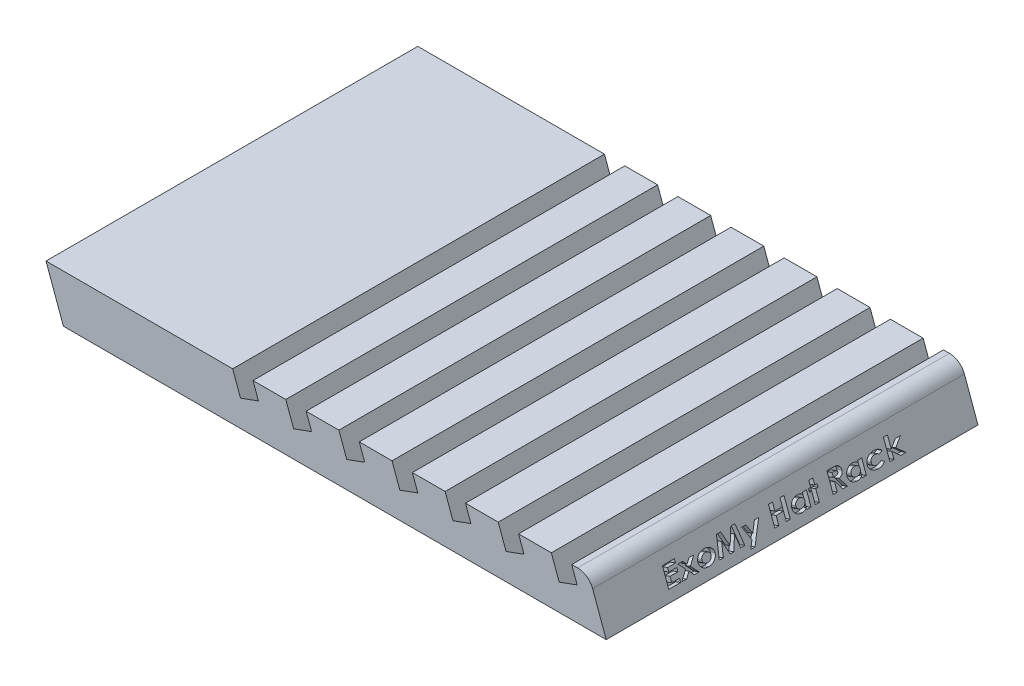
from build123d import *

# Parameters (mm, degrees)
SKETCH1_W               = 15
SKETCH1_H               = 70
BOSS_EXTRUDE1_DEPTH     = 9
CHAMFER1_SIZE           = 10.989909678
CHAMFER1_SIZE_2         = 4
CUT_EXTRUDE1_DEPTH      = 72.444995659
CUT_EXTRUDE1_DEPTH_BACK = 72.444995659
SKETCH2_W               = 16
SKETCH2_H               = 3.6
CUT_EXTRUDE2_START      = -2.4124
SKETCH3_W               = 70
SKETCH3_H               = 3.6
CUT_EXTRUDE2_DEPTH      = 4.310293
FILLET1_R               = 3
LPATTERN14_COUNT        = 7
LPATTERN14_PITCH        = 10
FILLET2_R               = 3
CUT_EXTRUDE3_DEPTH      = 1
MOVE_START              = -70
MOVE_FACE1_DEPTH        = 70
BODY_MOVE_COPY1_ANGLE   = 180


# Read off the part's stored shape, not the designer's step: Move Face1
with BuildPart() as part:
    # Sketch1 → Boss-Extrude1 (new body)
    with BuildSketch(Plane(origin=(0, 0, 0), x_dir=(1, 0, 0), z_dir=(0, 1, 0))):
        with Locations((7.5, 35)):
            Rectangle(SKETCH1_W, SKETCH1_H)
    extrude(amount=BOSS_EXTRUDE1_DEPTH)

    # Chamfer1
    # the kernel refuses this chamfer: 10.989909678, 4 mm, written as the material it takes off along each edge
    with BuildSketch(Plane(origin=(0, 9, -98.509965797), x_dir=(-0.013184058198645777, -0.9999130865277316, 0), z_dir=(0, 0, 1))) as chamfer1_piece_1:
        Polygon((CHAMFER1_SIZE * 0.999913086511, CHAMFER1_SIZE * 0.0131840581984), (-CHAMFER1_SIZE_2 * 0.0131840581986, CHAMFER1_SIZE_2 * 0.999913086528), (0, 0), align=None)
    extrude(amount=127.019931595, mode=Mode.SUBTRACT)
    with BuildSketch(Plane(origin=(15, 0, 28.509965797), x_dir=(0.013184058198645852, 0.9999130865277316, 0), z_dir=(0, 0, -1))) as chamfer1_piece_2:
        Polygon((CHAMFER1_SIZE * 0.999913086511, -CHAMFER1_SIZE * 0.0131840581984), (-CHAMFER1_SIZE_2 * 0.0131840581986, -CHAMFER1_SIZE_2 * 0.999913086528), (0, 0), align=None)
    extrude(amount=127.019931595, mode=Mode.SUBTRACT)

    # Sketch2 → Cut-Extrude1 (cut, two sides: drawn at the far end of the back side and taken through both)
    with BuildSketch(Plane(origin=(3.360455357, 9.232775213, 0), x_dir=(0, 0, 1), z_dir=(-0.3420201433256651, -0.9396926207859098, 0)).offset(-CUT_EXTRUDE1_DEPTH_BACK)):
        with Locations((-60.5, -5.508604011)):
            Rectangle(SKETCH2_W, SKETCH2_H)
        with Locations((-9.5, -5.508604011)):
            Rectangle(SKETCH2_W, SKETCH2_H)
    extrude(amount=CUT_EXTRUDE1_DEPTH + CUT_EXTRUDE1_DEPTH_BACK, mode=Mode.SUBTRACT)

    # Sketch3 → Cut-Extrude2 (cut)
    with BuildSketch(Plane(origin=(3.360455357, 9.232775213, 0), x_dir=(0, 0, 1), z_dir=(-0.3420201433256651, -0.9396926207859098, 0)).offset(CUT_EXTRUDE2_START)):
        with Locations((-35, -5.508604011)):
            Rectangle(SKETCH3_W, SKETCH3_H)
    extrude(amount=CUT_EXTRUDE2_DEPTH, mode=Mode.SUBTRACT)

    # Fillet1
    # the kernel refuses this fillet: 3 mm, written as the material it takes off along each edge
    with BuildSketch(Plane(origin=(9.579178979, 4.949649375, -1.5), x_dir=(-0.3420201433256651, -0.9396926207859098, 0), z_dir=(-0.9396926207859098, 0.3420201433256651, 0))) as fillet1_piece_1:
        with BuildLine():
            CenterArc((2.598076211, 3), FILLET1_R, 210, 60)
            Line((0, 1.5), (0, 0))
            Line((0, 0), (2.598076211, 0))
        make_face()
    extrude(amount=3.6, mode=Mode.SUBTRACT)
    with BuildSketch(Plane(origin=(6.196285544, 6.180921891, -17.5), x_dir=(0, 0, -1), z_dir=(0.9396926207859098, -0.3420201433256651, 0)), Plane(origin=(6.196285544, 6.180921891, -52.5), x_dir=(-0.34202014332566505, -0.9396926207859096, 0), z_dir=(0.9396926207859098, -0.3420201433256651, 0))) as fillet1_piece_2:
        with BuildLine():
            CenterArc((FILLET1_R, -FILLET1_R), FILLET1_R, 90, 90)
            Line((0, -FILLET1_R), (0, 0))
            Line((0, 0), (FILLET1_R, 0))
        make_face()
    extrude(amount=3.6, mode=Mode.SUBTRACT)
    with BuildSketch(Plane(origin=(9.579178979, 4.949649375, -68.5), x_dir=(0, 0, -1), z_dir=(-0.9396926207859098, 0.3420201433256651, 0))) as fillet1_piece_3:
        with BuildLine():
            CenterArc((3, 2.598076211), FILLET1_R, 180, 60)
            Line((0, 2.598076211), (0, 0))
            Line((0, 0), (1.5, 0))
        make_face()
    extrude(amount=3.6, mode=Mode.SUBTRACT)


with BuildPart() as lpattern14_1:
    # LPattern14: pattern copy
    add(part.part.moved(Location(Vector(1, 0, 0) * (1 * LPATTERN14_PITCH))))


with BuildPart() as lpattern14_2:
    # LPattern14: pattern copy
    add(part.part.moved(Location(Vector(1, 0, 0) * (2 * LPATTERN14_PITCH))))


with BuildPart() as lpattern14_3:
    # LPattern14: pattern copy
    add(part.part.moved(Location(Vector(1, 0, 0) * (3 * LPATTERN14_PITCH))))


with BuildPart() as lpattern14_4:
    # LPattern14: pattern copy
    add(part.part.moved(Location(Vector(1, 0, 0) * (4 * LPATTERN14_PITCH))))


with BuildPart() as lpattern14_5:
    # LPattern14: pattern copy
    add(part.part.moved(Location(Vector(1, 0, 0) * (5 * LPATTERN14_PITCH))))


with BuildPart() as lpattern14_6:
    # LPattern14: pattern copy
    add(part.part.moved(Location(Vector(1, 0, 0) * (6 * LPATTERN14_PITCH))))


with BuildPart() as part_1:
    add(part.part)

    # Combine1: union LPattern14_6, LPattern14_1, LPattern14_2, LPattern14_3, LPattern14_4, LPattern14_5
    add(lpattern14_6.part)
    add(lpattern14_1.part)
    add(lpattern14_2.part)
    add(lpattern14_3.part)
    add(lpattern14_4.part)
    add(lpattern14_5.part)

    # Fillet2
    fillet2_edges = [part_1.edges().sort_by_distance(p)[0] for p in [
        (4, 9, -35),
    ]]
    fillet(fillet2_edges, radius=FILLET2_R)

    # Sketch4 → Cut-Extrude3 (cut)
    # profile 1 of 12: a face of its own
    with BuildSketch(Plane(origin=(0.639544643, -0.232775213, 0), x_dir=(0, 0, 1), z_dir=(-0.9396926207859098, 0.34202014332566516, 0))):
        Polygon((-57.604824266, 5.547488193), (-55.361234522, 5.547488193), (-55.361234522, 4.919283065), (-56.842003753, 4.919283065), (-56.842003753, 4.246206142), (-55.361234522, 4.246206142), (-55.361234522, 3.618001014), (-56.842003753, 3.618001014), (-56.842003753, 2.675693321), (-55.361234522, 2.675693321), (-55.361234522, 2.047488193), (-57.604824266, 2.047488193), align=None)
    # profile 2 of 12: a face of its own
    with BuildSketch(Plane(origin=(0.639544643, -0.232775213, 0), x_dir=(0, 0, 1), z_dir=(-0.9396926207859098, 0.34202014332566516, 0))):
        Polygon((-55.021891574, 4.605180501), (-54.132168016, 4.605180501), (-53.525697663, 3.908265437), (-52.922031798, 4.605180501), (-52.033009362, 4.605180501), (-53.079784202, 3.396446526), (-51.906106317, 2.047488193), (-52.795829875, 2.047488193), (-53.523594298, 2.883926494), (-54.247853112, 2.047488193), (-55.136875548, 2.047488193), (-53.969507759, 3.395745405), align=None)
    # profile 3 of 12: a face of its own
    with BuildSketch(Plane(origin=(0.639544643, -0.232775213, 0), x_dir=(0, 0, 1), z_dir=(-0.9396926207859098, 0.34202014332566516, 0))):
        with BuildLine():
            add(Edge.make_bspline(
                [(-50.084591894, 4.650052296), (-50.048585419, 4.64951428), (-49.976941526, 4.648443763), (-49.870203929, 4.639804878), (-49.765198911, 4.625632111), (-49.661581157, 4.60705088), (-49.559841652, 4.581538591), (-49.459782254, 4.550593625), (-49.360966473, 4.515026026), (-49.265080796, 4.472850397), (-49.171952067, 4.426968901), (-49.08351446, 4.376638038), (-49.000837318, 4.321763093), (-48.922869384, 4.263517692), (-48.851291853, 4.200097733), (-48.783034053, 4.134391174), (-48.721671894, 4.063362468), (-48.665591479, 3.989026364), (-48.615159962, 3.912364395), (-48.571467855, 3.833317189), (-48.534306795, 3.752987019), (-48.503941413, 3.670911334), (-48.479952288, 3.587533015), (-48.463140386, 3.502398867), (-48.453155674, 3.415849674), (-48.4517065, 3.357676764), (-48.450978112, 3.328437712)],
                knots=[0, 0, 0, 0, 1.11282745, 2.214248718, 3.3073953, 4.387044838, 5.466283472, 6.547068225, 7.623401901, 8.710421146, 9.782966613, 10.83127689, 11.853068892, 12.848501143, 13.836567125, 14.807129212, 15.774810607, 16.734124436, 17.683816456, 18.608564961, 19.523271112, 20.416941416, 21.310961996, 22.202059403, 23.096313424, 24, 24, 24, 24], degree=3))
            add(Edge.make_bspline(
                [(-48.450978112, 3.328437712), (-48.451707245, 3.298965417), (-48.45315793, 3.240327319), (-48.463131793, 3.153075712), (-48.479981205, 3.06725695), (-48.503905448, 2.982835692), (-48.53488429, 2.900191859), (-48.572328378, 2.818840885), (-48.61672257, 2.739165161), (-48.666615867, 2.66065544), (-48.723896247, 2.586278835), (-48.784345042, 2.514063471), (-48.851780248, 2.447690165), (-48.922875893, 2.3842769), (-48.999706574, 2.326306496), (-49.080879027, 2.271914775), (-49.16684604, 2.22142453), (-49.257900312, 2.176146906), (-49.352358132, 2.135761499), (-49.449295077, 2.099627734), (-49.548866028, 2.069649016), (-49.650900778, 2.044977995), (-49.755322487, 2.026072446), (-49.862088166, 2.013077568), (-49.971092505, 2.004126611), (-50.044609661, 2.003123615), (-50.081787407, 2.002616398)],
                knots=[0, 0, 0, 0, 0.909223817, 1.808992312, 2.705519222, 3.604825348, 4.512876213, 5.425894602, 6.3650458, 7.325083872, 8.292727501, 9.259376648, 10.228094243, 11.208918944, 12.1967683, 13.194671296, 14.222322225, 15.270311755, 16.329748051, 17.390557501, 18.460346683, 19.535879317, 20.627723368, 21.732231364, 22.853185712, 24, 24, 24, 24], degree=3))
            add(Edge.make_bspline(
                [(-50.081787407, 2.002616398), (-50.13605166, 2.003914016), (-50.242762386, 2.006465784), (-50.399959988, 2.024079817), (-50.550987065, 2.054229831), (-50.695995107, 2.0963553), (-50.83508006, 2.150462937), (-50.967582593, 2.217479569), (-51.094831108, 2.295583534), (-51.213936498, 2.385392961), (-51.32368837, 2.482860077), (-51.418756453, 2.588148424), (-51.500161562, 2.697712447), (-51.566776843, 2.812861199), (-51.618347891, 2.933417794), (-51.654557497, 3.059193854), (-51.678284304, 3.189889459), (-51.680581917, 3.279020676), (-51.681747343, 3.324230982)],
                knots=[0, 0, 0, 0, 1.13037456, 2.222883093, 3.290371038, 4.334986959, 5.364770941, 6.394646991, 7.424235301, 8.470993352, 9.498380662, 10.477280453, 11.420855446, 12.336949679, 13.242176764, 14.145017838, 15.059091615, 16, 16, 16, 16], degree=3))
            add(Edge.make_bspline(
                [(-51.681747343, 3.324230982), (-51.680124605, 3.372479443), (-51.67692839, 3.467511665), (-51.65176102, 3.606805392), (-51.610164309, 3.739939746), (-51.551380018, 3.866743356), (-51.476498131, 3.987698979), (-51.384303858, 4.101459892), (-51.276416806, 4.20988628), (-51.1945019, 4.274166079), (-51.152400388, 4.307203738)],
                knots=[0, 0, 0, 0, 0.996992023, 1.963717908, 2.915734652, 3.873423307, 4.845483175, 5.849056382, 6.894487165, 8, 8, 8, 8], degree=3))
            add(Edge.make_bspline(
                [(-51.152400388, 4.307203738), (-51.113362833, 4.33479099), (-51.035928253, 4.389512842), (-50.912303157, 4.45864291), (-50.785093129, 4.517840736), (-50.653452954, 4.566680216), (-50.517234388, 4.60349449), (-50.3768641, 4.630250827), (-50.232220982, 4.646756062), (-50.134181105, 4.648945078), (-50.084591894, 4.650052296)],
                knots=[0, 0, 0, 0, 1.004823229, 1.993159313, 2.974022723, 3.953813955, 4.942382268, 5.938256273, 6.957156536, 8, 8, 8, 8], degree=3))
        make_face()
        with BuildLine():
            add(Edge.make_bspline(
                [(-50.067764971, 4.066718962), (-50.097692634, 4.06591537), (-50.156284726, 4.064342105), (-50.242329715, 4.055847164), (-50.323895874, 4.038208192), (-50.402365634, 4.016407452), (-50.476567323, 3.986270934), (-50.548220542, 3.951828681), (-50.614494425, 3.908420583), (-50.676809857, 3.860338989), (-50.733759557, 3.80753558), (-50.782544298, 3.749562041), (-50.825705732, 3.689285696), (-50.858997327, 3.623978737), (-50.886155988, 3.555787047), (-50.904745326, 3.483449439), (-50.917356385, 3.407873449), (-50.918398983, 3.356068049), (-50.91892683, 3.329839956)],
                knots=[0, 0, 0, 0, 1.141407707, 2.234637035, 3.290140179, 4.319480612, 5.335428471, 6.339624966, 7.345598836, 8.349043939, 9.338746116, 10.299423449, 11.233789626, 12.158418107, 13.086688811, 14.026857639, 15.001035382, 16, 16, 16, 16], degree=3))
            add(Edge.make_bspline(
                [(-50.91892683, 3.329839956), (-50.918336733, 3.302689698), (-50.917181698, 3.249546713), (-50.905688777, 3.171959264), (-50.886740774, 3.098354163), (-50.860019453, 3.028777428), (-50.825932788, 2.963110675), (-50.785340588, 2.900674793), (-50.735711255, 2.843366086), (-50.679595597, 2.790051765), (-50.617821746, 2.742102503), (-50.55109711, 2.700587436), (-50.481040093, 2.664379015), (-50.406334396, 2.635935517), (-50.328021904, 2.613342141), (-50.245717472, 2.597112833), (-50.159337997, 2.588274778), (-50.100502671, 2.586733749), (-50.070569458, 2.585949732)],
                knots=[0, 0, 0, 0, 1.029202734, 2.014526202, 2.96696449, 3.90694664, 4.834644214, 5.768882826, 6.724574225, 7.702694354, 8.700931557, 9.684698777, 10.679743001, 11.687186518, 12.711184654, 13.768146065, 14.864516221, 16, 16, 16, 16], degree=3))
            add(Edge.make_bspline(
                [(-50.070569458, 2.585949732), (-50.040627473, 2.586649774), (-49.981749403, 2.588026341), (-49.895241034, 2.598088346), (-49.812452719, 2.614070368), (-49.73341125, 2.636286004), (-49.658731317, 2.666172119), (-49.5877298, 2.701822236), (-49.520508105, 2.744245043), (-49.458004766, 2.793064439), (-49.400701667, 2.846562327), (-49.350309947, 2.90437952), (-49.308128498, 2.966370465), (-49.273514122, 3.031968449), (-49.246634302, 3.101139082), (-49.227962702, 3.174123948), (-49.215336934, 3.250642333), (-49.214317138, 3.303145057), (-49.213798625, 3.329839956)],
                knots=[0, 0, 0, 0, 1.131896637, 2.225767246, 3.288061208, 4.317317735, 5.324799949, 6.324580361, 7.317425251, 8.324907466, 9.318852724, 10.277285545, 11.218413819, 12.147266526, 13.076035169, 14.016914522, 14.991704378, 16, 16, 16, 16], degree=3))
            add(Edge.make_bspline(
                [(-49.213798625, 3.329839956), (-49.214395824, 3.356523646), (-49.215569594, 3.408969326), (-49.227065478, 3.485612782), (-49.245824369, 3.558367036), (-49.272934015, 3.626845706), (-49.306679594, 3.691907241), (-49.348181345, 3.753221493), (-49.397905438, 3.810050773), (-49.453526075, 3.863184289), (-49.515537373, 3.910778921), (-49.581809976, 3.952837865), (-49.652770418, 3.988265914), (-49.727782079, 4.016773783), (-49.806820725, 4.039310302), (-49.890042377, 4.05562007), (-49.977599475, 4.064381134), (-50.037365381, 4.065930756), (-50.067764971, 4.066718962)],
                knots=[0, 0, 0, 0, 1.012249738, 1.989534617, 2.934103707, 3.858249317, 4.778768889, 5.711264169, 6.660943005, 7.639796787, 8.626338021, 9.623076436, 10.614868228, 11.631345954, 12.664638796, 13.731098634, 14.845936138, 16, 16, 16, 16], degree=3))
        make_face(mode=Mode.SUBTRACT)
    # profile 4 of 12: a face of its own
    with BuildSketch(Plane(origin=(0.639544643, -0.232775213, 0), x_dir=(0, 0, 1), z_dir=(-0.9396926207859098, 0.34202014332566516, 0))):
        Polygon((-47.435052631, 5.547488193), (-46.650497343, 5.547488193), (-45.691362727, 3.106182103), (-44.729423625, 5.547488193), (-43.949075067, 5.547488193), (-43.290721702, 2.047488193), (-44.064059041, 2.047488193), (-44.479824266, 4.258125212), (-45.351318657, 2.047488193), (-46.034912407, 2.047488193), (-46.902901189, 4.258125212), (-47.317965291, 2.047488193), (-48.092003753, 2.047488193), align=None)
    # profile 5 of 12: a face of its own
    with BuildSketch(Plane(origin=(0.639544643, -0.232775213, 0), x_dir=(0, 0, 1), z_dir=(-0.9396926207859098, 0.34202014332566516, 0))):
        Polygon((-43.004664009, 4.605180501), (-42.228522183, 4.605180501), (-41.456587086, 3.016438514), (-40.601919618, 4.605180501), (-39.813157599, 4.605180501), (-41.695669618, 1.105180501), (-42.484431638, 1.105180501), (-41.864639971, 2.257824732), align=None)
    # profile 6 of 12: a face of its own
    with BuildSketch(Plane(origin=(0.639544643, -0.232775213, 0), x_dir=(0, 0, 1), z_dir=(-0.9396926207859098, 0.34202014332566516, 0))):
        Polygon((-37.636875548, 5.547488193), (-36.874055035, 5.547488193), (-36.874055035, 4.201334347), (-35.483029394, 4.201334347), (-35.483029394, 5.547488193), (-34.720208881, 5.547488193), (-34.720208881, 2.047488193), (-35.483029394, 2.047488193), (-35.483029394, 3.573129219), (-36.874055035, 3.573129219), (-36.874055035, 2.047488193), (-37.636875548, 2.047488193), align=None)
    # profile 7 of 12: a face of its own
    with BuildSketch(Plane(origin=(0.639544643, -0.232775213, 0), x_dir=(0, 0, 1), z_dir=(-0.9396926207859098, 0.34202014332566516, 0))):
        with BuildLine():
            Line((-31.57918324, 4.605180501), (-30.816362727, 4.605180501))
            Line((-30.816362727, 4.605180501), (-30.816362727, 2.047488193))
            Line((-30.816362727, 2.047488193), (-31.57918324, 2.047488193))
            Line((-31.57918324, 2.047488193), (-31.57918324, 2.326534667))
            add(Edge.make_bspline(
                [(-31.57918324, 2.326534667), (-31.616645081, 2.299303704), (-31.689815508, 2.246116217), (-31.804029268, 2.177861758), (-31.918433363, 2.121506343), (-32.033787196, 2.076593139), (-32.151801642, 2.043639142), (-32.273421875, 2.019647891), (-32.400097234, 2.005524136), (-32.486166066, 2.003596156), (-32.529904394, 2.002616398)],
                knots=[0, 0, 0, 0, 1.085199658, 2.119610796, 3.11432435, 4.071662673, 5.016806913, 5.982681155, 6.97484197, 8, 8, 8, 8], degree=3))
            add(Edge.make_bspline(
                [(-32.529904394, 2.002616398), (-32.579045929, 2.003533749), (-32.676044278, 2.005344467), (-32.818596024, 2.024509361), (-32.956179828, 2.053609487), (-33.088604733, 2.095151595), (-33.215828681, 2.148854992), (-33.338741487, 2.213383922), (-33.455683261, 2.291002433), (-33.566643007, 2.378690653), (-33.668212926, 2.475222657), (-33.758167906, 2.57851258), (-33.833624787, 2.688413161), (-33.894822229, 2.804084078), (-33.943115857, 2.925064576), (-33.9775376, 3.052034866), (-33.998156075, 3.184967882), (-34.000880315, 3.275547316), (-34.002260163, 3.321426494)],
                knots=[0, 0, 0, 0, 1.072203064, 2.116375208, 3.134085943, 4.13939264, 5.140963763, 6.145169392, 7.16543469, 8.20049272, 9.22899122, 10.220125012, 11.185271766, 12.1324506, 13.071348534, 14.023133203, 14.998701807, 16, 16, 16, 16], degree=3))
            add(Edge.make_bspline(
                [(-34.002260163, 3.321426494), (-34.00123076, 3.368951599), (-33.999207638, 3.462354363), (-33.977824768, 3.598986779), (-33.945386417, 3.729353922), (-33.898906131, 3.852955316), (-33.838367405, 3.969355379), (-33.766268755, 4.080318666), (-33.679212844, 4.183423212), (-33.580414542, 4.278999648), (-33.472759023, 4.365924462), (-33.358043402, 4.442137287), (-33.237421287, 4.506074626), (-33.111542012, 4.559093751), (-32.979681226, 4.599611904), (-32.842280129, 4.629205945), (-32.699114284, 4.647061065), (-32.601703329, 4.649046285), (-32.552340291, 4.650052296)],
                knots=[0, 0, 0, 0, 1.037629513, 2.039289848, 3.01399509, 3.969066808, 4.91686197, 5.87570764, 6.854470833, 7.858380471, 8.875194362, 9.873673655, 10.86282527, 11.853873124, 12.853657347, 13.872251987, 14.921762927, 16, 16, 16, 16], degree=3))
            add(Edge.make_bspline(
                [(-32.552340291, 4.650052296), (-32.506713753, 4.649256788), (-32.416334868, 4.647681013), (-32.283235013, 4.630672295), (-32.154122706, 4.605183884), (-32.029763709, 4.56821774), (-31.909173004, 4.522422429), (-31.794246995, 4.464147582), (-31.682845155, 4.397088116), (-31.613982668, 4.343898592), (-31.57918324, 4.317019443)],
                knots=[0, 0, 0, 0, 1.043190566, 2.066393859, 3.064554936, 4.050833321, 5.030773687, 6.011049422, 6.994890469, 8, 8, 8, 8], degree=3))
            Line((-31.57918324, 4.317019443), (-31.57918324, 4.605180501))
        make_face()
        with BuildLine():
            add(Edge.make_bspline(
                [(-32.393886766, 4.066718962), (-32.423588078, 4.065940902), (-32.481960674, 4.064411764), (-32.56761891, 4.055491958), (-32.649374674, 4.039546652), (-32.726746406, 4.015859341), (-32.801006163, 3.987435269), (-32.871138468, 3.951506668), (-32.937410158, 3.9090472), (-32.999454359, 3.861280971), (-33.055330643, 3.807950467), (-33.105084112, 3.751131024), (-33.146338666, 3.689922675), (-33.180505094, 3.625312555), (-33.207253349, 3.557146635), (-33.226202944, 3.484931438), (-33.237626537, 3.4092013), (-33.238829963, 3.357457158), (-33.23943965, 3.331242199)],
                knots=[0, 0, 0, 0, 1.137103226, 2.234772185, 3.292785389, 4.320247431, 5.328720436, 6.333017882, 7.330718426, 8.338238543, 9.325454513, 10.283246299, 11.223707734, 12.144168504, 13.076208939, 14.020195815, 14.996978562, 16, 16, 16, 16], degree=3))
            add(Edge.make_bspline(
                [(-33.23943965, 3.331242199), (-33.238910075, 3.304781812), (-33.237863999, 3.252514378), (-33.225275545, 3.176227208), (-33.206603376, 3.103243128), (-33.179726541, 3.034069223), (-33.145100758, 2.968483586), (-33.102962764, 2.906445646), (-33.052297401, 2.848688785), (-32.995516061, 2.79438811), (-32.932490144, 2.745766936), (-32.86587198, 2.702603576), (-32.795224764, 2.666827332), (-32.721308446, 2.63732676), (-32.643748452, 2.613814364), (-32.562416893, 2.598225112), (-32.477812608, 2.587994693), (-32.420326366, 2.58663926), (-32.391082279, 2.585949732)],
                knots=[0, 0, 0, 0, 1.005674303, 1.98651724, 2.933239103, 3.867775054, 4.802395589, 5.749367919, 6.71375225, 7.719976639, 8.733714942, 9.737500949, 10.735561031, 11.741038802, 12.762119612, 13.813561841, 14.887727113, 16, 16, 16, 16], degree=3))
            add(Edge.make_bspline(
                [(-32.391082279, 2.585949732), (-32.360913184, 2.586718287), (-32.301839692, 2.588223179), (-32.215025429, 2.597232496), (-32.132120272, 2.613153317), (-32.05348927, 2.6366208), (-31.978569879, 2.665406842), (-31.907348251, 2.700304323), (-31.840569406, 2.742947519), (-31.777626108, 2.790925038), (-31.720493689, 2.844259024), (-31.670891421, 2.902524105), (-31.628404516, 2.9643639), (-31.594067429, 3.030608967), (-31.5670085, 3.100642961), (-31.548501171, 3.174848578), (-31.535844968, 3.252751178), (-31.534828278, 3.306183397), (-31.534311445, 3.333345565)],
                knots=[0, 0, 0, 0, 1.136443868, 2.225247672, 3.283553779, 4.311399703, 5.311890576, 6.303981002, 7.29309875, 8.291418516, 9.2816325, 10.230728409, 11.168323684, 12.101486642, 13.034981717, 13.9893701, 14.977900078, 16, 16, 16, 16], degree=3))
            add(Edge.make_bspline(
                [(-31.534311445, 3.333345565), (-31.534815019, 3.360042319), (-31.535801073, 3.412317554), (-31.54855087, 3.488585273), (-31.567182302, 3.561327106), (-31.593721923, 3.630201035), (-31.628633673, 3.694790129), (-31.671126697, 3.755127923), (-31.720272777, 3.81266153), (-31.777912054, 3.864506908), (-31.840531391, 3.911919256), (-31.907555565, 3.953679568), (-31.978747992, 3.988744878), (-32.053965338, 4.017844255), (-32.13357548, 4.038959509), (-32.216612973, 4.055647919), (-32.303957423, 4.064394226), (-32.363488442, 4.065933144), (-32.393886766, 4.066718962)],
                knots=[0, 0, 0, 0, 1.01120993, 1.980062323, 2.923661129, 3.855114222, 4.771008705, 5.700267162, 6.648970465, 7.633741013, 8.633351921, 9.624362678, 10.623069726, 11.638503301, 12.676878783, 13.742243127, 14.84712162, 16, 16, 16, 16], degree=3))
        make_face(mode=Mode.SUBTRACT)
    # profile 8 of 12: a face of its own
    with BuildSketch(Plane(origin=(0.639544643, -0.232775213, 0), x_dir=(0, 0, 1), z_dir=(-0.9396926207859098, 0.34202014332566516, 0))):
        Polygon((-30.00867042, 5.637231783), (-29.245849907, 5.637231783), (-29.245849907, 4.605180501), (-28.797131958, 4.605180501), (-28.797131958, 4.066718962), (-29.245849907, 4.066718962), (-29.245849907, 2.047488193), (-30.00867042, 2.047488193), (-30.00867042, 4.066718962), (-30.412516574, 4.066718962), (-30.412516574, 4.605180501), (-30.00867042, 4.605180501), align=None)
    # profile 9 of 12: a face of its own
    with BuildSketch(Plane(origin=(0.639544643, -0.232775213, 0), x_dir=(0, 0, 1), z_dir=(-0.9396926207859098, 0.34202014332566516, 0))):
        with BuildLine():
            Line((-26.643285804, 5.547488193), (-25.804744138, 5.547488193))
            add(Edge.make_bspline(
                [(-25.804744138, 5.547488193), (-25.749350591, 5.547315657), (-25.642746285, 5.546983612), (-25.488939637, 5.541774765), (-25.347461932, 5.534513041), (-25.218352863, 5.523487839), (-25.101883318, 5.508865935), (-24.997777356, 5.491414307), (-24.905757752, 5.47179433), (-24.824818554, 5.447374715), (-24.751959652, 5.419668212), (-24.684183341, 5.387694178), (-24.61971653, 5.35230629), (-24.559140659, 5.312000417), (-24.502160433, 5.267743462), (-24.448735446, 5.219208325), (-24.398819604, 5.166467648), (-24.352702236, 5.109728026), (-24.310660475, 5.050068126), (-24.274596846, 4.986780916), (-24.24392266, 4.921125292), (-24.218197554, 4.852823733), (-24.199687654, 4.781492416), (-24.185529857, 4.70799536), (-24.176863945, 4.631561938), (-24.175852737, 4.579728966), (-24.175337086, 4.553297488)],
                knots=[0, 0, 0, 0, 1.836570219, 3.53446034, 5.10207051, 6.533260598, 7.829841073, 8.992934726, 10.032625301, 10.947036066, 11.793235874, 12.614808957, 13.429924994, 14.229421483, 15.024587688, 15.82001815, 16.620302857, 17.429949247, 18.242519826, 19.037383916, 19.841635455, 20.64338194, 21.453510251, 22.281780062, 23.123818469, 24, 24, 24, 24], degree=3))
            add(Edge.make_bspline(
                [(-24.175337086, 4.553297488), (-24.175800715, 4.525693181), (-24.176710998, 4.471495156), (-24.186094305, 4.391986265), (-24.201301851, 4.31590656), (-24.223479549, 4.243369357), (-24.250325297, 4.173794976), (-24.28461102, 4.108039446), (-24.324332166, 4.045717873), (-24.370610615, 3.987039314), (-24.422256168, 3.931430969), (-24.481296375, 3.880293552), (-24.545550502, 3.831606429), (-24.617116792, 3.787685648), (-24.694070517, 3.746335741), (-24.777385784, 3.708274472), (-24.866913988, 3.674069486), (-24.929396866, 3.654588673), (-24.961294618, 3.644643642)],
                knots=[0, 0, 0, 0, 1.016086139, 1.994973482, 2.943504488, 3.869195015, 4.784910831, 5.685580803, 6.595129019, 7.502394393, 8.433946935, 9.385206858, 10.374891841, 11.399326033, 12.473554863, 13.590341435, 14.769859888, 16, 16, 16, 16], degree=3))
            Line((-24.961294618, 3.644643642), (-23.973414009, 2.047488193))
            Line((-23.973414009, 2.047488193), (-24.833690452, 2.047488193))
            Line((-24.833690452, 2.047488193), (-25.777400388, 3.573129219))
            Line((-25.777400388, 3.573129219), (-25.880465291, 3.573129219))
            Line((-25.880465291, 3.573129219), (-25.880465291, 2.047488193))
            Line((-25.880465291, 2.047488193), (-26.643285804, 2.047488193))
            Line((-26.643285804, 2.047488193), (-26.643285804, 5.547488193))
        make_face()
        with BuildLine():
            Line((-25.880465291, 4.201334347), (-25.623854715, 4.201334347))
            add(Edge.make_bspline(
                [(-25.623854715, 4.201334347), (-25.592536763, 4.20167081), (-25.5324512, 4.202316338), (-25.445874205, 4.205330736), (-25.367075774, 4.212482472), (-25.295773467, 4.22169035), (-25.232023745, 4.231992411), (-25.176239018, 4.247250199), (-25.127570484, 4.263436188), (-25.086117988, 4.283265989), (-25.050883121, 4.30627154), (-25.020342513, 4.332143751), (-24.994970769, 4.362198155), (-24.973361692, 4.395082949), (-24.958426182, 4.432505557), (-24.9462124, 4.472255209), (-24.939078516, 4.515886619), (-24.9384728, 4.546026694), (-24.938157599, 4.561710949)],
                knots=[0, 0, 0, 0, 1.708363675, 3.277608857, 4.723712974, 6.021838054, 7.199660436, 8.241690857, 9.172961181, 9.993967569, 10.739999558, 11.46313589, 12.168296226, 12.87908003, 13.598837728, 14.357076655, 15.145057537, 16, 16, 16, 16], degree=3))
            add(Edge.make_bspline(
                [(-24.938157599, 4.561710949), (-24.938801309, 4.580279105), (-24.940067829, 4.616812523), (-24.955001274, 4.669147051), (-24.977505531, 4.718208532), (-25.01031818, 4.761886142), (-25.049743576, 4.801638074), (-25.09631669, 4.835158721), (-25.148911893, 4.862795252), (-25.197767517, 4.880385745), (-25.242450528, 4.891346315), (-25.282689898, 4.898951714), (-25.329537385, 4.905008118), (-25.382347183, 4.910686675), (-25.441748863, 4.91478576), (-25.507444182, 4.91753275), (-25.579679936, 4.918721586), (-25.629930923, 4.919090763), (-25.656106317, 4.919283065)],
                knots=[0, 0, 0, 0, 0.985252127, 1.938513972, 2.873098658, 3.843165384, 4.828025027, 5.842890392, 6.883115312, 7.980634618, 8.595920604, 9.330050158, 10.158404267, 11.108741491, 12.156004298, 13.326020887, 14.60714262, 16, 16, 16, 16], degree=3))
            Line((-25.656106317, 4.919283065), (-25.880465291, 4.919283065))
            Line((-25.880465291, 4.919283065), (-25.880465291, 4.201334347))
        make_face(mode=Mode.SUBTRACT)
    # profile 10 of 12: a face of its own
    with BuildSketch(Plane(origin=(0.639544643, -0.232775213, 0), x_dir=(0, 0, 1), z_dir=(-0.9396926207859098, 0.34202014332566516, 0))):
        with BuildLine():
            Line((-21.16892683, 4.605180501), (-20.406106317, 4.605180501))
            Line((-20.406106317, 4.605180501), (-20.406106317, 2.047488193))
            Line((-20.406106317, 2.047488193), (-21.16892683, 2.047488193))
            Line((-21.16892683, 2.047488193), (-21.16892683, 2.326534667))
            add(Edge.make_bspline(
                [(-21.16892683, 2.326534667), (-21.206388671, 2.299303704), (-21.279559098, 2.246116217), (-21.393772857, 2.177861758), (-21.508176953, 2.121506343), (-21.623530786, 2.076593139), (-21.741545232, 2.043639142), (-21.863165465, 2.019647891), (-21.989840824, 2.005524136), (-22.075909655, 2.003596156), (-22.119647984, 2.002616398)],
                knots=[0, 0, 0, 0, 1.085199658, 2.119610796, 3.11432435, 4.071662673, 5.016806913, 5.982681155, 6.97484197, 8, 8, 8, 8], degree=3))
            add(Edge.make_bspline(
                [(-22.119647984, 2.002616398), (-22.168789519, 2.003533749), (-22.265787868, 2.005344467), (-22.408339613, 2.024509361), (-22.545923417, 2.053609487), (-22.678348323, 2.095151595), (-22.805572271, 2.148854992), (-22.928485077, 2.213383922), (-23.045426851, 2.291002433), (-23.156386597, 2.378690653), (-23.257956516, 2.475222657), (-23.347911496, 2.57851258), (-23.423368377, 2.688413161), (-23.484565819, 2.804084078), (-23.532859447, 2.925064576), (-23.56728119, 3.052034866), (-23.587899664, 3.184967882), (-23.590623904, 3.275547316), (-23.592003753, 3.321426494)],
                knots=[0, 0, 0, 0, 1.072203064, 2.116375208, 3.134085943, 4.13939264, 5.140963763, 6.145169392, 7.16543469, 8.20049272, 9.22899122, 10.220125012, 11.185271766, 12.1324506, 13.071348534, 14.023133203, 14.998701807, 16, 16, 16, 16], degree=3))
            add(Edge.make_bspline(
                [(-23.592003753, 3.321426494), (-23.59097435, 3.368951599), (-23.588951228, 3.462354363), (-23.567568358, 3.598986779), (-23.535130007, 3.729353922), (-23.48864972, 3.852955316), (-23.428110995, 3.969355379), (-23.356012345, 4.080318666), (-23.268956434, 4.183423212), (-23.170158131, 4.278999648), (-23.062502612, 4.365924462), (-22.947786992, 4.442137287), (-22.827164877, 4.506074626), (-22.701285602, 4.559093751), (-22.569424816, 4.599611904), (-22.432023719, 4.629205945), (-22.288857874, 4.647061065), (-22.191446918, 4.649046285), (-22.142083881, 4.650052296)],
                knots=[0, 0, 0, 0, 1.037629513, 2.039289848, 3.01399509, 3.969066808, 4.91686197, 5.87570764, 6.854470833, 7.858380471, 8.875194362, 9.873673655, 10.86282527, 11.853873124, 12.853657347, 13.872251987, 14.921762927, 16, 16, 16, 16], degree=3))
            add(Edge.make_bspline(
                [(-22.142083881, 4.650052296), (-22.096457343, 4.649256788), (-22.006078458, 4.647681013), (-21.872978603, 4.630672295), (-21.743866295, 4.605183884), (-21.619507299, 4.56821774), (-21.498916594, 4.522422429), (-21.383990585, 4.464147582), (-21.272588745, 4.397088116), (-21.203726258, 4.343898592), (-21.16892683, 4.317019443)],
                knots=[0, 0, 0, 0, 1.043190566, 2.066393859, 3.064554936, 4.050833321, 5.030773687, 6.011049422, 6.994890469, 8, 8, 8, 8], degree=3))
            Line((-21.16892683, 4.317019443), (-21.16892683, 4.605180501))
        make_face()
        with BuildLine():
            add(Edge.make_bspline(
                [(-21.983630356, 4.066718962), (-22.013331668, 4.065940902), (-22.071704264, 4.064411764), (-22.1573625, 4.055491958), (-22.239118263, 4.039546652), (-22.316489996, 4.015859341), (-22.390749752, 3.987435269), (-22.460882058, 3.951506668), (-22.527153748, 3.9090472), (-22.589197949, 3.861280971), (-22.645074233, 3.807950467), (-22.694827702, 3.751131024), (-22.736082256, 3.689922675), (-22.770248684, 3.625312555), (-22.796996939, 3.557146635), (-22.815946533, 3.484931438), (-22.827370126, 3.4092013), (-22.828573553, 3.357457158), (-22.82918324, 3.331242199)],
                knots=[0, 0, 0, 0, 1.137103226, 2.234772185, 3.292785389, 4.320247431, 5.328720436, 6.333017882, 7.330718426, 8.338238543, 9.325454513, 10.283246299, 11.223707734, 12.144168504, 13.076208939, 14.020195815, 14.996978562, 16, 16, 16, 16], degree=3))
            add(Edge.make_bspline(
                [(-22.82918324, 3.331242199), (-22.828653664, 3.304781812), (-22.827607588, 3.252514378), (-22.815019135, 3.176227208), (-22.796346965, 3.103243128), (-22.769470131, 3.034069223), (-22.734844348, 2.968483586), (-22.692706354, 2.906445646), (-22.642040991, 2.848688785), (-22.58525965, 2.79438811), (-22.522233734, 2.745766936), (-22.45561557, 2.702603576), (-22.384968354, 2.666827332), (-22.311052035, 2.63732676), (-22.233492041, 2.613814364), (-22.152160483, 2.598225112), (-22.067556198, 2.587994693), (-22.010069956, 2.58663926), (-21.980825868, 2.585949732)],
                knots=[0, 0, 0, 0, 1.005674303, 1.98651724, 2.933239103, 3.867775054, 4.802395589, 5.749367919, 6.71375225, 7.719976639, 8.733714942, 9.737500949, 10.735561031, 11.741038802, 12.762119612, 13.813561841, 14.887727113, 16, 16, 16, 16], degree=3))
            add(Edge.make_bspline(
                [(-21.980825868, 2.585949732), (-21.950656774, 2.586718287), (-21.891583282, 2.588223179), (-21.804769019, 2.597232496), (-21.721863862, 2.613153317), (-21.643232859, 2.6366208), (-21.568313468, 2.665406842), (-21.49709184, 2.700304323), (-21.430312996, 2.742947519), (-21.367369698, 2.790925038), (-21.310237279, 2.844259024), (-21.26063501, 2.902524105), (-21.218148106, 2.9643639), (-21.183811019, 3.030608967), (-21.15675209, 3.100642961), (-21.138244761, 3.174848578), (-21.125588558, 3.252751178), (-21.124571868, 3.306183397), (-21.124055035, 3.333345565)],
                knots=[0, 0, 0, 0, 1.136443868, 2.225247672, 3.283553779, 4.311399703, 5.311890576, 6.303981002, 7.29309875, 8.291418516, 9.2816325, 10.230728409, 11.168323684, 12.101486642, 13.034981717, 13.9893701, 14.977900078, 16, 16, 16, 16], degree=3))
            add(Edge.make_bspline(
                [(-21.124055035, 3.333345565), (-21.124558609, 3.360042319), (-21.125544663, 3.412317554), (-21.13829446, 3.488585273), (-21.156925892, 3.561327106), (-21.183465512, 3.630201035), (-21.218377263, 3.694790129), (-21.260870286, 3.755127923), (-21.310016367, 3.81266153), (-21.367655644, 3.864506908), (-21.43027498, 3.911919256), (-21.497299155, 3.953679568), (-21.568491581, 3.988744878), (-21.643708927, 4.017844255), (-21.72331907, 4.038959509), (-21.806356562, 4.055647919), (-21.893701013, 4.064394226), (-21.953232032, 4.065933144), (-21.983630356, 4.066718962)],
                knots=[0, 0, 0, 0, 1.01120993, 1.980062323, 2.923661129, 3.855114222, 4.771008705, 5.700267162, 6.648970465, 7.633741013, 8.633351921, 9.624362678, 10.623069726, 11.638503301, 12.676878783, 13.742243127, 14.84712162, 16, 16, 16, 16], degree=3))
        make_face(mode=Mode.SUBTRACT)
    # profile 11 of 12: a face of its own
    with BuildSketch(Plane(origin=(0.639544643, -0.232775213, 0), x_dir=(0, 0, 1), z_dir=(-0.9396926207859098, 0.34202014332566516, 0))):
        with BuildLine():
            Line((-16.771490933, 4.083545885), (-17.388478112, 3.797488193))
            add(Edge.make_bspline(
                [(-17.388478112, 3.797488193), (-17.417039873, 3.821406535), (-17.472206577, 3.867604529), (-17.559122648, 3.925799758), (-17.64477306, 3.973824325), (-17.732119643, 4.009222418), (-17.822536961, 4.035841134), (-17.918905081, 4.053411629), (-18.022238933, 4.065085294), (-18.093538389, 4.066163549), (-18.130264971, 4.066718962)],
                knots=[0, 0, 0, 0, 1.103909083, 2.132187352, 3.096727176, 4.010412356, 4.920437356, 5.886767879, 6.911467239, 8, 8, 8, 8], degree=3))
            add(Edge.make_bspline(
                [(-18.130264971, 4.066718962), (-18.16417973, 4.066042743), (-18.230285834, 4.064724668), (-18.327026427, 4.05453617), (-18.418840061, 4.038968661), (-18.505851311, 4.015550134), (-18.587810027, 3.985628755), (-18.664822704, 3.948647765), (-18.737441432, 3.906287555), (-18.803634551, 3.856243704), (-18.863857716, 3.80214364), (-18.916328903, 3.743392219), (-18.960585376, 3.681070822), (-18.996836202, 3.614651052), (-19.02582308, 3.545018618), (-19.045241886, 3.470904035), (-19.057501568, 3.393584568), (-19.059126295, 3.34063771), (-19.059952471, 3.313714155)],
                knots=[0, 0, 0, 0, 1.214406064, 2.367100774, 3.480374074, 4.546323316, 5.589686325, 6.600546516, 7.602530944, 8.595242742, 9.567056008, 10.497810063, 11.410511647, 12.298309598, 13.202953976, 14.104456344, 15.036113241, 16, 16, 16, 16], degree=3))
            add(Edge.make_bspline(
                [(-19.059952471, 3.313714155), (-19.059462673, 3.287479255), (-19.058503859, 3.236122628), (-19.045529722, 3.161091249), (-19.027467549, 3.089210239), (-18.999290826, 3.021613184), (-18.965172669, 2.957282511), (-18.922259159, 2.896997365), (-18.87183718, 2.840471401), (-18.814227809, 2.787922313), (-18.750659734, 2.740363604), (-18.681553874, 2.698919057), (-18.607741816, 2.663514041), (-18.528733271, 2.63599106), (-18.445440519, 2.61312681), (-18.3572442, 2.597165447), (-18.264130698, 2.588220267), (-18.200629804, 2.586718462), (-18.168125548, 2.585949732)],
                knots=[0, 0, 0, 0, 0.974467834, 1.907588079, 2.824701923, 3.725357249, 4.623702822, 5.528041483, 6.470025763, 7.435927707, 8.423334588, 9.417603839, 10.428451666, 11.462172499, 12.524867627, 13.638149819, 14.79103776, 16, 16, 16, 16], degree=3))
            add(Edge.make_bspline(
                [(-18.168125548, 2.585949732), (-18.127892352, 2.586700914), (-18.049787412, 2.588159188), (-17.936051948, 2.601067992), (-17.829056372, 2.62193259), (-17.72864957, 2.651056398), (-17.635176597, 2.689271151), (-17.548630264, 2.73563308), (-17.468435613, 2.790207282), (-17.421176806, 2.833550455), (-17.397592695, 2.855180501)],
                knots=[0, 0, 0, 0, 1.152768366, 2.237875981, 3.275622612, 4.273904361, 5.229171849, 6.164146266, 7.08383265, 8, 8, 8, 8], degree=3))
            Line((-17.397592695, 2.855180501), (-16.816362727, 2.520044283))
            add(Edge.make_bspline(
                [(-16.816362727, 2.520044283), (-16.856981252, 2.478527423), (-16.937987899, 2.395729201), (-17.07715089, 2.290893623), (-17.227226298, 2.200713978), (-17.390586013, 2.128880161), (-17.565266101, 2.071827938), (-17.752215467, 2.031295595), (-17.951563001, 2.007496116), (-18.08859913, 2.004272668), (-18.159010965, 2.002616398)],
                knots=[0, 0, 0, 0, 0.939166774, 1.873006254, 2.811296146, 3.768258199, 4.755374824, 5.781766195, 6.860228235, 8, 8, 8, 8], degree=3))
            add(Edge.make_bspline(
                [(-18.159010965, 2.002616398), (-18.222390087, 2.0038195), (-18.345682552, 2.006159915), (-18.525499035, 2.024554709), (-18.694572523, 2.055106023), (-18.853525625, 2.097846663), (-19.001950661, 2.152920273), (-19.139450749, 2.221424313), (-19.266528055, 2.301528879), (-19.38171531, 2.393488454), (-19.485118053, 2.49317283), (-19.575075004, 2.598530028), (-19.651704214, 2.707671405), (-19.713772881, 2.821358741), (-19.762631801, 2.939309348), (-19.797896436, 3.061502198), (-19.818634792, 3.188206714), (-19.821383748, 3.273908694), (-19.822772984, 3.317219764)],
                knots=[0, 0, 0, 0, 1.285014524, 2.499760222, 3.660771722, 4.765570467, 5.833318407, 6.865471824, 7.875208599, 8.873649548, 9.848956835, 10.783468759, 11.678764605, 12.548302852, 13.404632485, 14.262612863, 15.121979506, 16, 16, 16, 16], degree=3))
            add(Edge.make_bspline(
                [(-19.822772984, 3.317219764), (-19.82205171, 3.347393358), (-19.820622133, 3.407197953), (-19.810613975, 3.496076375), (-19.793794361, 3.583304334), (-19.769914104, 3.668582466), (-19.739621213, 3.752112936), (-19.702087522, 3.833433835), (-19.658794231, 3.913623685), (-19.608180837, 3.991305021), (-19.551580001, 4.065924626), (-19.489738979, 4.137136278), (-19.422200512, 4.203880943), (-19.349160616, 4.266220422), (-19.270833888, 4.324600305), (-19.18772904, 4.37935965), (-19.098626056, 4.429067512), (-19.005173779, 4.475296878), (-18.90729561, 4.516474062), (-18.806160206, 4.552261641), (-18.702228456, 4.582511293), (-18.595388203, 4.606726991), (-18.48601741, 4.626906898), (-18.373545043, 4.639548712), (-18.258482612, 4.648553868), (-18.180764032, 4.649549218), (-18.14148292, 4.650052296)],
                knots=[0, 0, 0, 0, 0.909693515, 1.803028562, 2.693022361, 3.585467631, 4.47045396, 5.36913679, 6.283566765, 7.215877034, 8.161539749, 9.105494424, 10.05720245, 11.021762874, 11.99842218, 13.001046652, 14.020175531, 15.072739892, 16.143289312, 17.219759293, 18.305781347, 19.40489231, 20.521727855, 21.657104925, 22.815836266, 24, 24, 24, 24], degree=3))
            add(Edge.make_bspline(
                [(-18.14148292, 4.650052296), (-18.105012858, 4.649713695), (-18.033170859, 4.649046689), (-17.926710709, 4.64179064), (-17.823315724, 4.629952646), (-17.72254058, 4.613571961), (-17.624439262, 4.593953463), (-17.52948089, 4.567278348), (-17.437138096, 4.537572156), (-17.347825231, 4.502933519), (-17.26172239, 4.464751702), (-17.179723636, 4.42180485), (-17.101436559, 4.375401606), (-17.027046114, 4.325040085), (-16.956979827, 4.270227672), (-16.890963507, 4.211933895), (-16.828687534, 4.150062198), (-16.790604661, 4.105774037), (-16.771490933, 4.083545885)],
                knots=[0, 0, 0, 0, 1.142488134, 2.250575573, 3.341399902, 4.401944287, 5.448826637, 6.473790044, 7.490323015, 8.487069054, 9.473650569, 10.439804209, 11.385400528, 12.323682528, 13.252314947, 14.170525195, 15.081789752, 16, 16, 16, 16], degree=3))
        make_face()
    # profile 12 of 12: a face of its own
    with BuildSketch(Plane(origin=(0.639544643, -0.232775213, 0), x_dir=(0, 0, 1), z_dir=(-0.9396926207859098, 0.34202014332566516, 0))):
        Polygon((-15.963798625, 5.637231783), (-15.200978112, 5.637231783), (-15.200978112, 3.543682103), (-14.084091093, 4.605180501), (-13.124956477, 4.605180501), (-14.40730824, 3.386630821), (-12.939159202, 2.047488193), (-13.917224106, 2.047488193), (-15.200978112, 3.219062712), (-15.200978112, 2.047488193), (-15.963798625, 2.047488193), align=None)
    extrude(amount=-CUT_EXTRUDE3_DEPTH, mode=Mode.SUBTRACT)

    # Move Face1 outline → Move Face1 (add)
    with BuildSketch(Plane.XY.offset(MOVE_START)):
        Polygon((106.201065283, 9), (74.275732108, 9), (71, 0), (102.925333174, 0), align=None)
    extrude(amount=MOVE_FACE1_DEPTH)


with BuildPart() as part_2:
    # Body-Move/Copy1: moved
    add(part_1.part.rotate(Axis((53.462666587, 0, -35), (0, 1, 0)), BODY_MOVE_COPY1_ANGLE))


solid = part_2.part
